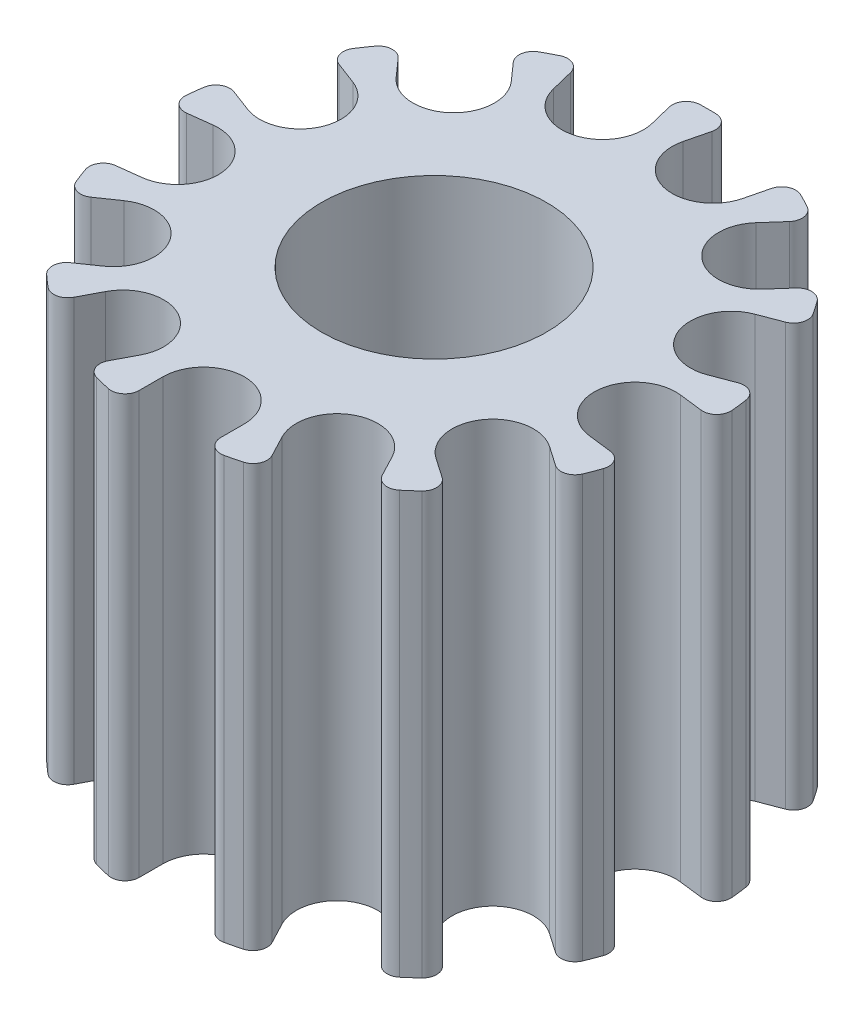
from build123d import *

# Parameters (mm, degrees)
BOSS_EXTRUDE1_DEPTH      = 7.5
CUT_EXTRUDE1_START       = -7.5
CUT_EXTRUDE1_DEPTH       = 15
FILLET1_R                = 0.5
CIRPATTERN1_COUNT        = 13
FILLET1_OF_CIRPATTERN1_R = 0.5
CUT_EXTRUDE2_DEPTH       = 16.666124697
CUT_EXTRUDE2_DEPTH_BACK  = 16.666124697
SKETCH7_R                = 4


# Read off the part's stored shape, not the designer's step: Cut-Extrude1
with BuildPart() as part:
    # Sketch5 → Boss-Extrude1 (new, symmetric)
    with BuildSketch(Plane(origin=(0, 0, 0), x_dir=(1, 0, 0), z_dir=(0, 1, 0))):
        with BuildLine():
            ThreePointArc((-0.898321896, 9.703578331), (-2.332148212, 9.46189724), (-3.714053167, 9.009562905))
            Line((-3.714053167, 9.009562905), (-3.369074568, 7.60992971))
            ThreePointArc((-3.369074568, 7.60992971), (-1.614201219, 6.549071788), (-0.553343297, 8.303945136))
            Line((-0.553343297, 8.303945136), (-0.898321896, 9.703578331))
        make_face()
        with BuildLine():
            Line((-3.369074568, 7.60992971), (-3.714053167, 9.009562905))
            ThreePointArc((-3.714053167, 9.009562905), (-5.420917899, -8.098151875), (9.745071301, 0))
            ThreePointArc((9.745071301, 0), (6.565523731, 7.201410473), (-0.898321896, 9.703578331))
            Line((-0.898321896, 9.703578331), (-0.553343297, 8.303945136))
            ThreePointArc((-0.553343297, 8.303945136), (-1.614201219, 6.549071788), (-3.369074568, 7.60992971))
        make_face()
    extrude(amount=BOSS_EXTRUDE1_DEPTH, both=True)

    # Cut-Extrude1 outline → Cut-Extrude1 (cut)
    with BuildSketch(Plane(origin=(0, 0, 0), x_dir=(1, 0, 0), z_dir=(0, 1, 0)).offset(CUT_EXTRUDE1_START)):
        with BuildLine():
            ThreePointArc((-0.898321896, 9.703578331), (-2.332148212, 9.46189724), (-3.714053167, 9.009562905))
            Line((-3.714053167, 9.009562905), (-3.369074568, 7.60992971))
            ThreePointArc((-3.369074568, 7.60992971), (-1.61420122, 6.549071788), (-0.553343297, 8.303945136))
            Line((-0.553343297, 8.303945136), (-0.898321896, 9.703578331))
        make_face()
    cut_extrude1 = extrude(amount=CUT_EXTRUDE1_DEPTH, mode=Mode.SUBTRACT)

    # Fillet1
    fillet1_edges = [part.edges().sort_by_distance(p)[0] for p in [
        (-3.714053167, 0, -9.009562905),
        (-0.898321896, 0, -9.703578331),
    ]]
    fillet(fillet1_edges, radius=FILLET1_R)

    # CirPattern1: Cut-Extrude1 ×13 about axis
    cirpattern1_axis = Axis((0, 0, 0), (0, 1, 0))
    for i in range(1, CIRPATTERN1_COUNT):
        add(cut_extrude1.rotate(cirpattern1_axis, i * 360 / CIRPATTERN1_COUNT), mode=Mode.SUBTRACT)

    # Fillet1 of CirPattern1
    fillet1_of_cirpattern1_edges = [part.edges().sort_by_distance(p)[0] for p in [
        (-7.475583408, 0, -6.251565194),
        (-5.304902238, 0, -8.174620903),
        (-9.524547581, 0, -2.061409236),
        (-8.496193408, 0, -4.77295634),
        (-9.391552687, 0, 2.600990735),
        (-9.741109059, 0, -0.277865001),
        (-7.107066252, 0, 6.667535074),
        (-8.754454018, 0, 4.280881862),
        (-3.194436588, 0, 9.20662748),
        (-5.762259063, 0, 7.85893028),
        (1.45, 0, 9.636592482),
        (-1.45, 0, 9.636592482),
        (5.762259064, 0, 7.85893028),
        (3.194436589, 0, 9.206627479),
        (8.754454018, 0, 4.280881862),
        (7.107066252, 0, 6.667535073),
        (9.741109059, 0, -0.277865001),
        (9.391552686, 0, 2.600990734),
        (8.496193408, 0, -4.772956341),
        (9.524547581, 0, -2.061409237),
        (5.304902238, 0, -8.174620903),
        (7.475583408, 0, -6.251565194),
        (0.898321896, 0, -9.703578332),
        (3.714053167, 0, -9.009562905),
    ]]
    fillet(fillet1_of_cirpattern1_edges, radius=FILLET1_OF_CIRPATTERN1_R)

    # Sketch7 → Cut-Extrude2 (cut, two sides: drawn at the far end of the back side and taken through both)
    with BuildSketch(Plane(origin=(0, 0, 0), x_dir=(1, 0, 0), z_dir=(0, 1, 0)).offset(-CUT_EXTRUDE2_DEPTH_BACK)):
        with Locations(Location((0, 0, 0), (0, 0, 270))):
            Circle(SKETCH7_R)
    extrude(amount=CUT_EXTRUDE2_DEPTH + CUT_EXTRUDE2_DEPTH_BACK, mode=Mode.SUBTRACT)


solid = part.part
